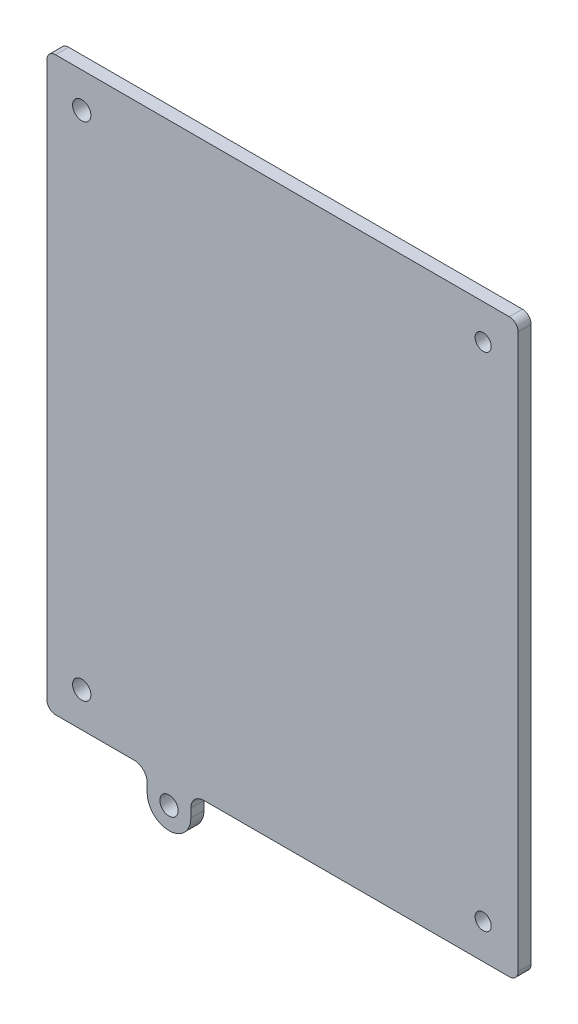
from build123d import *

# Parameters (mm, degrees)
SKETCH2_R           = 2.1
SKETCH2_R_2         = 1.85
BOSS_EXTRUDE1_DEPTH = 3
FILLET1_R           = 2
FILLET2_R           = 3


with BuildPart() as part:
    # Sketch2 → Boss-Extrude1 (new body)
    with BuildSketch(Plane.XY):
        with BuildLine():
            Line((0.167188, 159.1806075), (0.167188, 28.18105))
            Line((0.167188, 28.18105), (23.16763175, 28.18105))
            Line((23.16763175, 28.18105), (23.16763175, 23.18105))
            ThreePointArc((23.16763175, 23.18105), (28.16763175, 18.18105), (33.16763175, 23.18105))
            Line((33.16763175, 23.18105), (33.16763175, 28.18105))
            Line((33.16763175, 28.18105), (108.16728925, 28.18105))
            Line((108.16728925, 28.18105), (108.16728925, 159.1806075))
            Line((108.16728925, 159.1806075), (0.167188, 159.1806075))
        make_face()
        with Locations((8.16763175, 151.180160625)):
            Circle(SKETCH2_R, mode=Mode.SUBTRACT)
        with Locations((100.1668405, 151.180160625)):
            Circle(SKETCH2_R_2, mode=Mode.SUBTRACT)
        with Locations((100.1668405, 36.181495)):
            Circle(SKETCH2_R_2, mode=Mode.SUBTRACT)
        with Locations((8.16763175, 36.181495)):
            Circle(SKETCH2_R, mode=Mode.SUBTRACT)
        with Locations((28.16763175, 23.18105)):
            Circle(SKETCH2_R, mode=Mode.SUBTRACT)
    extrude(amount=BOSS_EXTRUDE1_DEPTH)

    # Fillet1
    fillet1_edges = [part.edges().sort_by_distance(p)[0] for p in [
        (0.167188, 159.1806075, 1.5),
        (0.167188, 28.18105, 1.5),
        (108.16728925, 159.1806075, 1.5),
        (108.16728925, 28.18105, 1.5),
    ]]
    fillet(fillet1_edges, radius=FILLET1_R)

    # Fillet2
    fillet2_edges = [part.edges().sort_by_distance(p)[0] for p in [
        (33.16763175, 28.18105, 1.5),
        (23.16763175, 28.18105, 1.5),
    ]]
    fillet(fillet2_edges, radius=FILLET2_R)


solid = part.part
